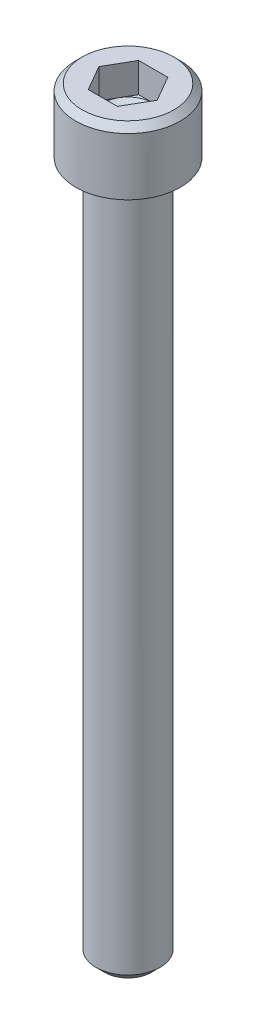
from build123d import *

# Parameters (mm, degrees)
SKETCH1_W           = 2.8702
SKETCH1_H           = 3.5052
SKETCH2_R           = 1.7526
BOSS_EXTRUDE1_DEPTH = 38.1
CUT_EXTRUDE1_DEPTH  = 1.6256
CHAMFER1_SIZE       = 0.47244
CHAMFER2_SIZE       = 0.3556
FILLET1_R           = 0.254


with BuildPart() as part:
    # Sketch1 → Revolve1 (revolve)
    with BuildSketch(Plane.XY):
        with Locations((1.4351, 1.7526)):
            Rectangle(SKETCH1_W, SKETCH1_H)
    revolve(axis=Axis((0, 3.5052, 0), (0, -1, 0)))

    # Sketch2 → Boss-Extrude1 (add)
    with BuildSketch(Plane.XZ):
        Circle(SKETCH2_R)
    extrude(amount=BOSS_EXTRUDE1_DEPTH)

    # Sketch3 → Cut-Extrude1 (cut)
    with BuildSketch(Plane(origin=(0, 3.5052, 0), x_dir=(-1, 0, 0), z_dir=(0, 1, 0))):
        Polygon((-0.799225978, 1.3843), (-1.598451955, 0), (-0.799225978, -1.3843), (0.799225978, -1.3843), (1.598451955, 0), (0.799225978, 1.3843), align=None)
    extrude(amount=-CUT_EXTRUDE1_DEPTH, mode=Mode.SUBTRACT)

    # Sketch4 → Cut-Revolve1 (revolve, cut)
    with BuildSketch(Plane.XY):
        Polygon((1.3843, 1.8796), (0, 1.8796), (0, 1.080374022), align=None)
    revolve(axis=Axis((0, 1.879625, 0), (0, -1, 0)), mode=Mode.SUBTRACT)

    # Chamfer1
    chamfer1_edges = [part.edges().sort_by_distance(p)[0] for p in [
        (-1.7526, -38.1, 0),
    ]]
    chamfer(chamfer1_edges, length=CHAMFER1_SIZE)

    # Chamfer2
    chamfer2_edges = [part.edges().sort_by_distance(p)[0] for p in [
        (-2.8702, 3.5052, 0),
    ]]
    chamfer(chamfer2_edges, length=CHAMFER2_SIZE)

    # Fillet1
    fillet1_edges = [part.edges().sort_by_distance(p)[0] for p in [
        (-1.7526, 0, 0),
    ]]
    fillet(fillet1_edges, radius=FILLET1_R)


solid = part.part
